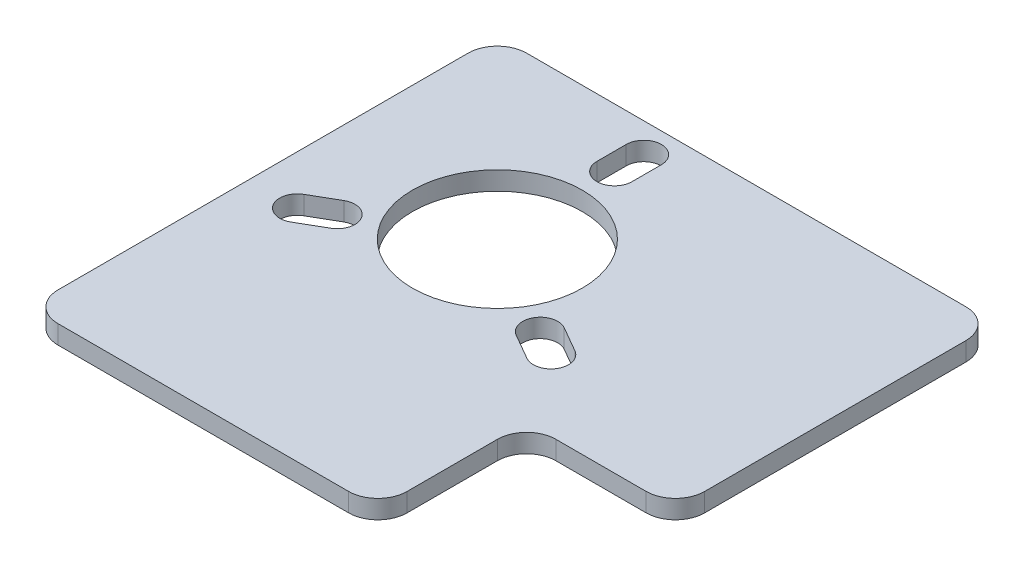
from build123d import *

# Parameters (mm, degrees)
SKETCH1_W           = 170
SKETCH1_H           = 160
SKETCH1_R           = 29
BOSS_EXTRUDE1_DEPTH = 6.35
SKETCH2_W           = 50.8
SKETCH2_H           = 50.8
CUT_EXTRUDE1_DEPTH  = 234.538695937
FILLET1_R           = 10
CUT_EXTRUDE2_DEPTH  = 234.538695937


with BuildPart() as part:
    # Sketch1 → Boss-Extrude1 (new body)
    with BuildSketch(Plane(origin=(0, 0, 0), x_dir=(1, 0, 0), z_dir=(0, 1, 0))):
        with Locations((85, 80)):
            Rectangle(SKETCH1_W, SKETCH1_H)
        with Locations((60, 100)):
            Circle(SKETCH1_R, mode=Mode.SUBTRACT)
    extrude(amount=BOSS_EXTRUDE1_DEPTH)

    # Sketch2 → Cut-Extrude1 (cut, through all)
    with BuildSketch(Plane(origin=(0, 6.35, 0), x_dir=(1, 0, 0), z_dir=(0, 1, 0))):
        with Locations((144.6, 25.4)):
            Rectangle(SKETCH2_W, SKETCH2_H)
    extrude(amount=-CUT_EXTRUDE1_DEPTH, mode=Mode.SUBTRACT)

    # Fillet1
    fillet1_edges = [part.edges().sort_by_distance(p)[0] for p in [
        (170, 3.175, -160),
        (0, 3.175, -160),
        (119.2, 3.175, -50.8),
        (119.2, 3.175, 0),
        (170, 3.175, -50.8),
        (0, 3.175, 0),
    ]]
    fillet(fillet1_edges, radius=FILLET1_R)

    # Sketch3 → Cut-Extrude2 (cut, through all)
    with BuildSketch(Plane(origin=(0, 6.35, 0), x_dir=(1, 0, 0), z_dir=(0, 1, 0))):
        with BuildLine():
            Line((13.698729811, 80.196152423), (22.358983849, 85.196152423))
            ThreePointArc((22.358983849, 85.196152423), (30.555136271, 83), (28.358983849, 74.803847577))
            Line((28.358983849, 74.803847577), (19.698729811, 69.803847577))
            ThreePointArc((19.698729811, 69.803847577), (11.502577388, 72), (13.698729811, 80.196152423))
        make_face()
        with BuildLine():
            Line((100.301270189, 69.803847577), (91.641016151, 74.803847577))
            ThreePointArc((91.641016151, 74.803847577), (89.444863729, 83), (97.641016151, 85.196152423))
            Line((97.641016151, 85.196152423), (106.301270189, 80.196152423))
            ThreePointArc((106.301270189, 80.196152423), (108.497422612, 72), (100.301270189, 69.803847577))
        make_face()
        with BuildLine():
            Line((66, 150), (66, 140))
            ThreePointArc((66, 140), (60, 134), (54, 140))
            Line((54, 140), (54, 150))
            ThreePointArc((54, 150), (60, 156), (66, 150))
        make_face()
    extrude(amount=-CUT_EXTRUDE2_DEPTH, mode=Mode.SUBTRACT)


solid = part.part
